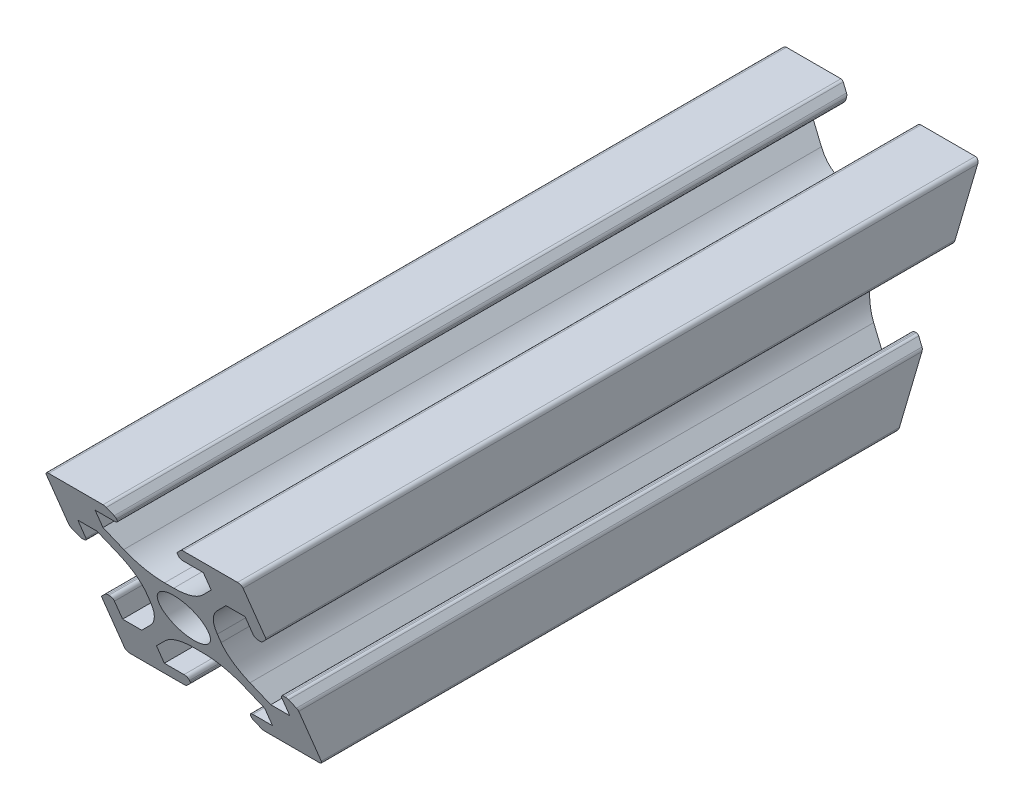
from build123d import *

# Parameters (mm, degrees)
RESSALTO_EXTRUS_O1_DEPTH = 75
PADR_OCIRCULAR1_COUNT    = 4
FILETE1_R                = 0.4
SKETCH3_R                = 2
CUT_EXTRUDE2_DEPTH       = 79.262379212
CUT_EXTRUDE1_DEPTH       = 79.262379308


with BuildPart() as part:
    # Esboço1 → Ressalto-extrusão1 (new body)
    with BuildSketch(Plane.XY):
        with BuildLine():
            ThreePointArc((-9.317157288, 3.217157288), (-9.187387948, 3.130448187), (-9.034314575, 3.1))
            Line((-9.034314575, 3.1), (-8.9, 3.1))
            ThreePointArc((-8.9, 3.1), (-8.617157288, 3.217157288), (-8.5, 3.5))
            Line((-8.5, 3.5), (-8.5, 5.5))
            Line((-8.5, 5.5), (-6.560660172, 5.5))
            Line((-6.560660172, 5.5), (-5.064466094, 4.003805922))
            ThreePointArc((-5.064466094, 4.003805922), (-3.980602337, 2.381689178), (-3.6, 0.468272016))
            Line((-3.6, 0.468272016), (-3.6, 0))
            Line((-3.6, 0), (-2.5, 0))
            ThreePointArc((-2.5, 0), (-1.767766953, 1.767766953), (0, 2.5))
            Line((0, 2.5), (0, 3.6))
            Line((0, 3.6), (-0.468272016, 3.6))
            ThreePointArc((-0.468272016, 3.6), (-2.381689178, 3.980602337), (-4.003805922, 5.064466094))
            Line((-4.003805922, 5.064466094), (-5.5, 6.560660172))
            Line((-5.5, 6.560660172), (-5.5, 8.5))
            Line((-5.5, 8.5), (-3.5, 8.5))
            ThreePointArc((-3.5, 8.5), (-3.217157288, 8.617157288), (-3.1, 8.9))
            Line((-3.1, 8.9), (-3.1, 9.034314575))
            ThreePointArc((-3.1, 9.034314575), (-3.130448187, 9.187387948), (-3.217157288, 9.317157288))
            Line((-3.217157288, 9.317157288), (-3.782842712, 9.882842712))
            ThreePointArc((-3.782842712, 9.882842712), (-3.912612052, 9.969551813), (-4.065685425, 10))
            Line((-4.065685425, 10), (-10, 10))
            Line((-10, 10), (-10, 4.065685425))
            ThreePointArc((-10, 4.065685425), (-9.969551813, 3.912612052), (-9.882842712, 3.782842712))
            Line((-9.882842712, 3.782842712), (-9.317157288, 3.217157288))
        make_face()
    ressalto_extrus_o1 = extrude(amount=RESSALTO_EXTRUS_O1_DEPTH)

    # PadrãoCircular1: Ressalto-extrusão1 ×4 about axis
    padr_ocircular1_axis = Axis((0, 0, 0), (0, 0, 1))
    for i in range(1, PADR_OCIRCULAR1_COUNT):
        add(ressalto_extrus_o1.rotate(padr_ocircular1_axis, i * 360 / PADR_OCIRCULAR1_COUNT))

    # Filete1
    filete1_edges = [part.edges().sort_by_distance(p)[0] for p in [
        (-10, -10, 37.5),
        (-10, 10, 37.5),
        (10, -10, 37.5),
        (10, 10, 37.5),
    ]]
    fillet(filete1_edges, radius=FILETE1_R)

    # Sketch3 → Cut-Extrude2 (cut, through all)
    with BuildSketch(Plane(origin=(10, 0, 0), x_dir=(0, 0, -1), z_dir=(1, 0, 0))):
        with Locations((-27.5, 0)):
            Circle(SKETCH3_R)
        with Locations((-47.5, 0)):
            Circle(SKETCH3_R)
    extrude(amount=-CUT_EXTRUDE2_DEPTH, mode=Mode.SUBTRACT)

    # Sketch1 → Cut-Extrude1 (cut, through all)
    with BuildSketch(Plane.ZY.offset(10)):
        Polygon((0, 10), (0, -10), (8.284271247, -10), align=None)
        Polygon((75, 10), (66.715728753, -10), (75, -10), align=None)
    extrude(amount=-CUT_EXTRUDE1_DEPTH, mode=Mode.SUBTRACT)


solid = part.part
